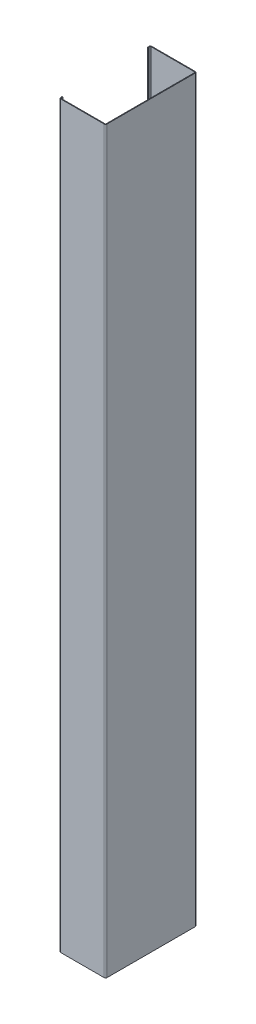
from build123d import *

# Parameters (mm, degrees)
MOVE_BODY_2_DEPTH    = 3000
SKETCH_6_OUTSIDE_W   = 652.406
SKETCH_6_OUTSIDE_H   = 3602.406
SKETCH_6_OUTSIDE_W_2 = 50
SKETCH_6_OUTSIDE_H_2 = 799.25
CUT_EXTRUDE_1_DEPTH  = 3003.033019472


# Read off the part's stored shape, not the designer's step: Тело-Переместить/Копировать2
with BuildPart() as part:
    # Move Body 2 outline → Move Body 2 (new body)
    with BuildSketch(Plane(origin=(0, 0, 0), x_dir=(1, 0, 0), z_dir=(0, 1, 0))):
        with BuildLine():
            Line((-50, 47.75), (-50, 46.25))
            Line((-50, 46.25), (-49.25, 46.25))
            Line((-49.25, 46.25), (-49.25, 47.75))
            ThreePointArc((-49.25, 47.75), (-49.030330086, 48.280330086), (-48.5, 48.5))
            Line((-48.5, 48.5), (-1.5, 48.5))
            ThreePointArc((-1.5, 48.5), (-0.969669914, 48.280330086), (-0.75, 47.75))
            Line((-0.75, 47.75), (-0.75, -47.75))
            ThreePointArc((-0.75, -47.75), (-0.969669914, -48.280330086), (-1.5, -48.5))
            Line((-1.5, -48.5), (-48.5, -48.5))
            ThreePointArc((-48.5, -48.5), (-49.030330086, -48.280330086), (-49.25, -47.75))
            Line((-49.25, -47.75), (-49.25, -46.25))
            Line((-49.25, -46.25), (-50, -46.25))
            Line((-50, -46.25), (-50, -47.75))
            ThreePointArc((-50, -47.75), (-49.560660172, -48.810660172), (-48.5, -49.25))
            Line((-48.5, -49.25), (-1.5, -49.25))
            ThreePointArc((-1.5, -49.25), (-0.439339828, -48.810660172), (0, -47.75))
            Line((0, -47.75), (0, 47.75))
            ThreePointArc((0, 47.75), (-0.439339828, 48.810660172), (-1.5, 49.25))
            Line((-1.5, 49.25), (-48.5, 49.25))
            ThreePointArc((-48.5, 49.25), (-49.560660172, 48.810660172), (-50, 47.75))
        make_face()
    extrude(amount=MOVE_BODY_2_DEPTH)

    # Эскиз6 outside → Вырез-Вытянуть1 (cut, through all)
    with BuildSketch(Plane.XY.offset(49.25)):
        with Locations((-25, 1500)):
            Rectangle(SKETCH_6_OUTSIDE_W, SKETCH_6_OUTSIDE_H)
        with Locations((-25, 2600.375)):
            Rectangle(SKETCH_6_OUTSIDE_W_2, SKETCH_6_OUTSIDE_H_2, mode=Mode.SUBTRACT)
    extrude(amount=-CUT_EXTRUDE_1_DEPTH, mode=Mode.SUBTRACT)


solid = part.part
